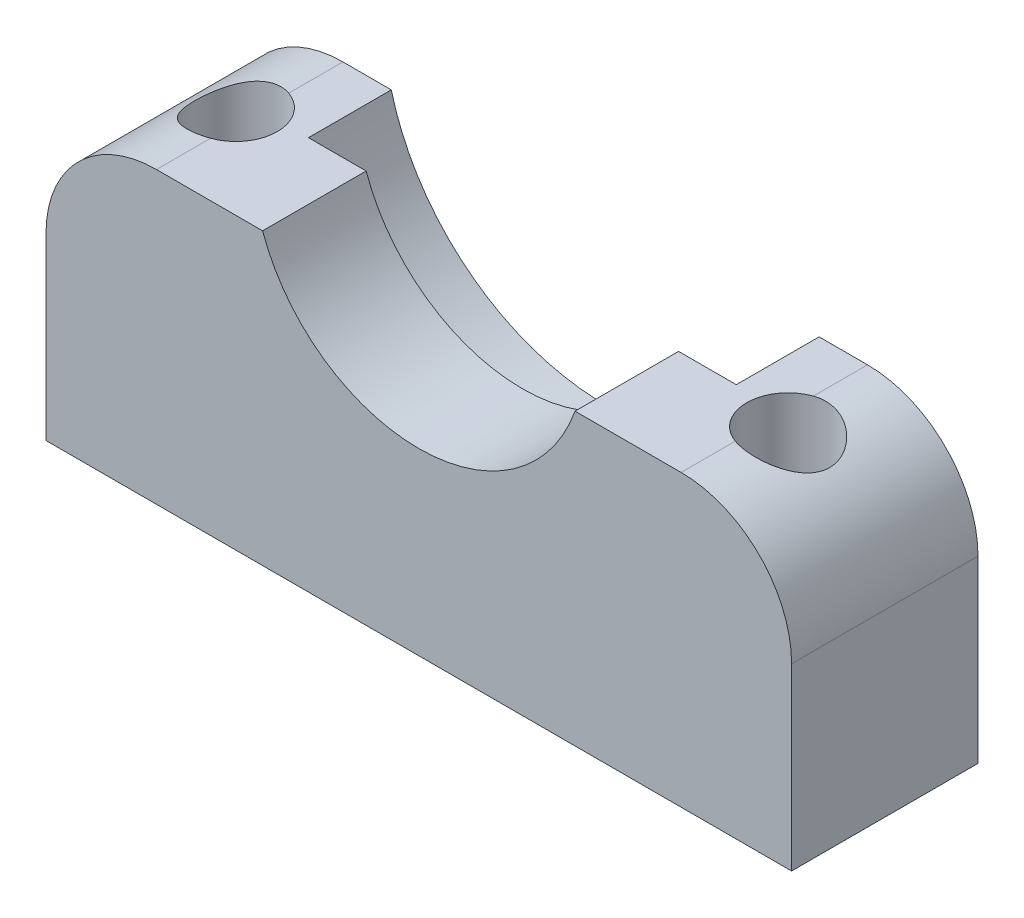
from build123d import *

# Parameters (mm, degrees)
BOSS_EXTRUDE1_DEPTH = 6.75
SKETCH3_R           = 8
CUT_EXTRUDE2_DEPTH  = 3
SKETCH4_W           = 27
SKETCH4_H           = 2
CUT_EXTRUDE3_DEPTH  = 9
SKETCH5_R           = 1.5
CUT_EXTRUDE4_DEPTH  = 16
FILLET1_R           = 4


with BuildPart() as part:
    # Sketch1 → Boss-Extrude1 (new body)
    with BuildSketch(Plane.XY):
        with BuildLine():
            Line((-27, 0), (0, 0))
            Line((0, 0), (0, 12.5))
            Line((0, 12.5), (-7.5, 12.5))
            ThreePointArc((-7.5, 12.5), (-13.5, 6.5), (-19.5, 12.5))
            Line((-19.5, 12.5), (-27, 12.5))
            Line((-27, 12.5), (-27, 0))
        make_face()
    extrude(amount=BOSS_EXTRUDE1_DEPTH)

    # Sketch3 → Cut-Extrude2 (cut)
    with BuildSketch(Plane(origin=(0, 0, 0), x_dir=(-1, 0, 0), z_dir=(0, 0, -1))):
        with Locations((13.5, 12.5)):
            Circle(SKETCH3_R)
    extrude(amount=-CUT_EXTRUDE2_DEPTH, mode=Mode.SUBTRACT)

    # Sketch4 → Cut-Extrude3 (cut)
    with BuildSketch(Plane.XY.offset(6.75)):
        with Locations((-13.5, 11.5)):
            Rectangle(SKETCH4_W, SKETCH4_H)
    extrude(amount=-CUT_EXTRUDE3_DEPTH, mode=Mode.SUBTRACT)

    # Sketch5 → Cut-Extrude4 (cut)
    with BuildSketch(Plane.XZ):
        with Locations((-23.5, 3.375)):
            Circle(SKETCH5_R)
        with Locations((-3.5, 3.375)):
            Circle(SKETCH5_R)
    extrude(amount=-CUT_EXTRUDE4_DEPTH, mode=Mode.SUBTRACT)

    # Fillet1
    # the kernel refuses this fillet: 4 mm, written as the material it takes off along each edge
    with BuildSketch(Plane(origin=(-27, 10.5, 16.75), x_dir=(1, 0, 0), z_dir=(0, 0, -1))) as fillet1_piece_1:
        with BuildLine():
            CenterArc((FILLET1_R, FILLET1_R), FILLET1_R, 180, 90)
            Line((0, FILLET1_R), (0, 0))
            Line((0, 0), (FILLET1_R, 0))
        make_face()
    extrude(amount=26.75, mode=Mode.SUBTRACT)
    with BuildSketch(Plane(origin=(0, 10.5, 16.75), x_dir=(-1, 0, 0), z_dir=(0, 0, -1))) as fillet1_piece_2:
        with BuildLine():
            CenterArc((FILLET1_R, -FILLET1_R), FILLET1_R, 90, 90)
            Line((0, -FILLET1_R), (0, 0))
            Line((0, 0), (FILLET1_R, 0))
        make_face()
    extrude(amount=26.75, mode=Mode.SUBTRACT)


solid = part.part
